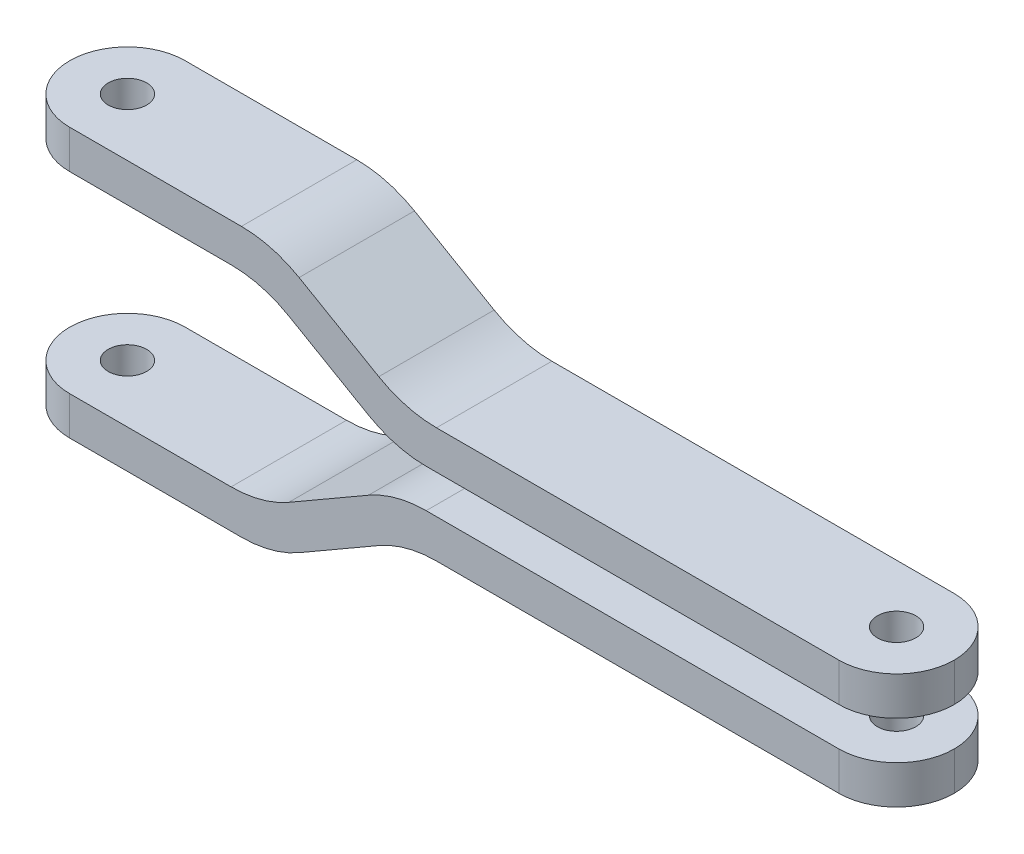
from build123d import *

# Parameters (mm, degrees)
SALIENTE_EXTRUIR1_DEPTH = 15
REDONDEO3_R             = 15
REDONDEO2_R             = 30
CORTAR_EXTRUIR1_REACH   = 220.346
CROQUIS4_R              = 5


with BuildPart() as part:
    # Croquis3 → Saliente-Extruir1 (new, symmetric)
    with BuildSketch(Plane(origin=(0, 0, 0), x_dir=(0, 1, 0), z_dir=(0, 0, 1))):
        Polygon((-25, 215), (-25, 150), (-5, 115.358983849), (-5, -15), (-15, -15), (-15, 112.679491924), (-35, 147.320508076), (-35, 215), align=None)
    extrude(amount=SALIENTE_EXTRUIR1_DEPTH, both=True)

    # Redondeo3
    redondeo3_edges = [part.edges().sort_by_distance(p)[0] for p in [
        (15, -10, 15),
        (15, -10, -15),
        (-215, -30, -15),
        (-215, -30, 15),
    ]]
    fillet(redondeo3_edges, radius=REDONDEO3_R - 0.0001)  # a hair under: the kernel refuses the full size

    # Redondeo2
    redondeo2_edges = [part.edges().sort_by_distance(p)[0] for p in [
        (-150, -25, 0),
        (-115.358983849, -5, 0),
        (-112.679491924, -15, 0),
        (-147.320508076, -35, 0),
    ]]
    fillet(redondeo2_edges, radius=REDONDEO2_R)

    # Croquis4 → Cortar-Extruir1 (cut, up to next)
    with BuildSketch(Plane(origin=(0, 0, 0), x_dir=(-1, 0, 0), z_dir=(0, 1, 0)), mode=Mode.PRIVATE) as cortar_extruir1_sk1:
        with Locations(Location((0, 0, 0), (0, 0, 180))):
            Circle(CROQUIS4_R)
    cortar_extruir1_tool1 = extrude(cortar_extruir1_sk1.sketch, amount=-CORTAR_EXTRUIR1_REACH, mode=Mode.PRIVATE) & part.part
    # Croquis4 → Cortar-Extruir1 (cut, up to next)
    with BuildSketch(Plane(origin=(0, 0, 0), x_dir=(-1, 0, 0), z_dir=(0, 1, 0)), mode=Mode.PRIVATE) as cortar_extruir1_sk2:
        with Locations(Location((200, 0, 0), (0, 0, 180))):
            Circle(CROQUIS4_R)
    cortar_extruir1_tool2 = extrude(cortar_extruir1_sk2.sketch, amount=-CORTAR_EXTRUIR1_REACH, mode=Mode.PRIVATE) & part.part
    add(cortar_extruir1_tool1.solids().sort_by_distance((0, 0, 0))[0], mode=Mode.SUBTRACT)
    add(cortar_extruir1_tool2.solids().sort_by_distance((-200, 0, 0))[0], mode=Mode.SUBTRACT)


with BuildPart() as body_2:
    # Simetría2: mirrored copy
    add(part.part.mirror(Plane.ZX))


solid = Compound([part.part, body_2.part])
